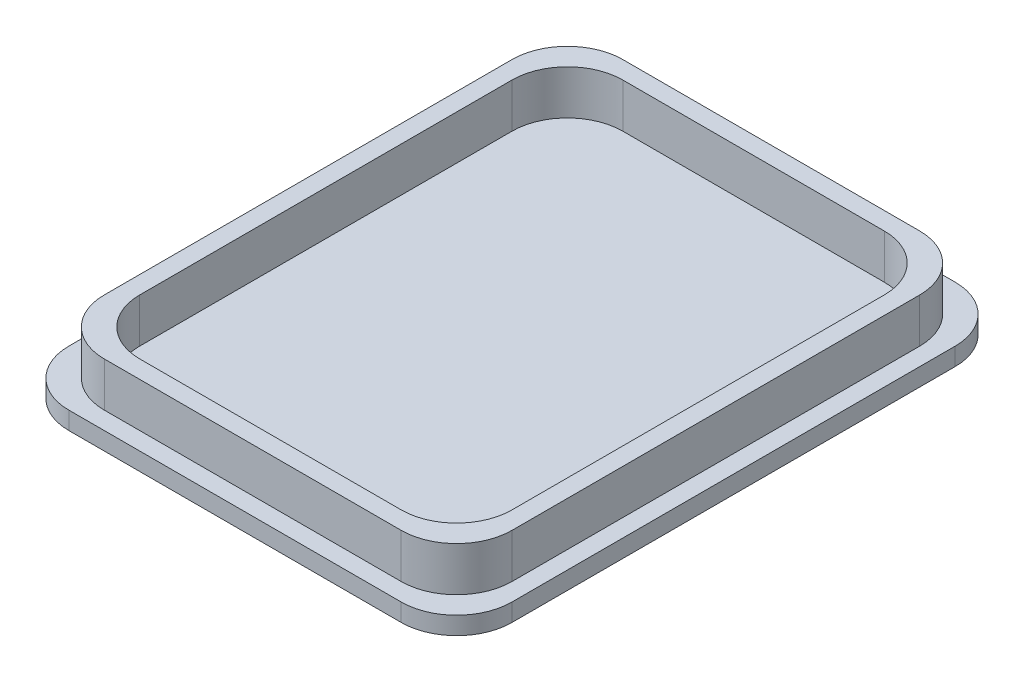
from build123d import *

# Parameters (mm, degrees)
SKETCH1_W           = 40
SKETCH1_H           = 50
BOSS_EXTRUDE1_DEPTH = 1.6
SKETCH2_W           = 36.8
SKETCH2_H           = 46.8
SKETCH2_W_2         = 33.6
SKETCH2_H_2         = 43.6
BOSS_EXTRUDE2_DEPTH = 4
FILLET1_R           = 5


with BuildPart() as part:
    # Sketch1 → Boss-Extrude1 (new body)
    with BuildSketch(Plane(origin=(0, 0, 0), x_dir=(1, 0, 0), z_dir=(0, 1, 0))):
        Rectangle(SKETCH1_W, SKETCH1_H)
    extrude(amount=BOSS_EXTRUDE1_DEPTH)

    # Sketch2 → Boss-Extrude2 (add)
    with BuildSketch(Plane(origin=(0, 1.6, 0), x_dir=(1, 0, 0), z_dir=(0, 1, 0))):
        Rectangle(SKETCH2_W, SKETCH2_H)
        Rectangle(SKETCH2_W_2, SKETCH2_H_2, mode=Mode.SUBTRACT)
    extrude(amount=BOSS_EXTRUDE2_DEPTH)

    # Fillet1
    fillet1_edges = [part.edges().sort_by_distance(p)[0] for p in [
        (-16.8, 3.6, 21.8),
        (16.8, 3.6, 21.8),
        (16.8, 3.6, -21.8),
        (-18.4, 3.6, -23.4),
        (-20, 0.8, 25),
        (20, 0.8, 25),
        (20, 0.8, -25),
        (18.4, 3.6, -23.4),
        (-18.4, 3.6, 23.4),
        (18.4, 3.6, 23.4),
        (-16.8, 3.6, -21.8),
        (-20, 0.8, -25),
    ]]
    fillet(fillet1_edges, radius=FILLET1_R)


solid = part.part
